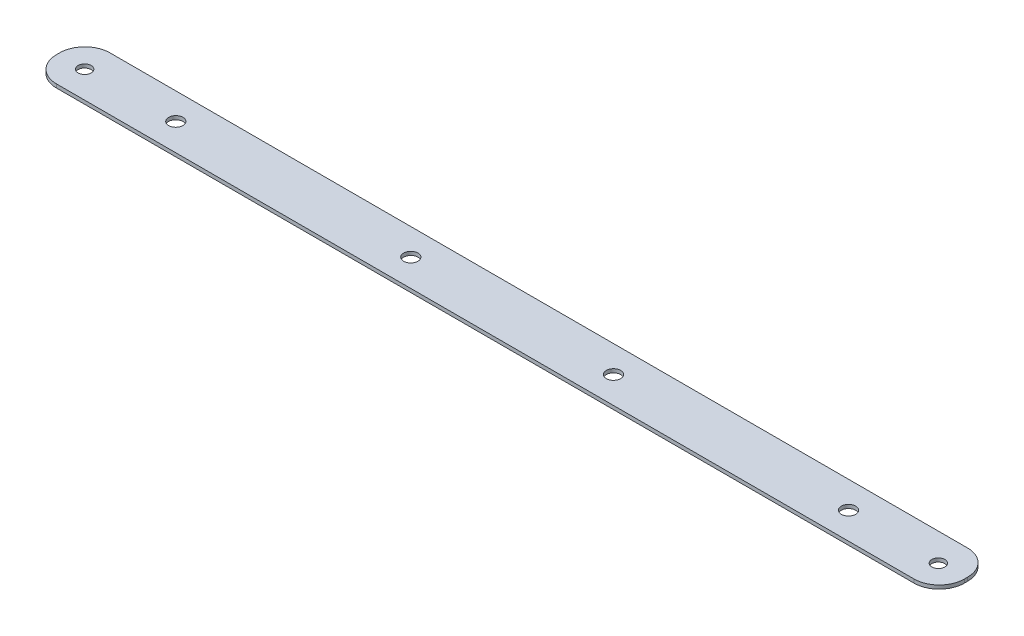
from build123d import *

# Parameters (mm, degrees)
SKETCH1_W                = 215.9
SKETCH1_H                = 12.75
SKETCH1_R                = 1.55
BASE_FLANGE1_DEPTH       = 0.86
FILLET1_R                = 6
M3_CLEARANCE_HOLE1_D     = 3.4
M3_CLEARANCE_HOLE1_DEPTH = 1.29
M3_CLEARANCE_HOLE1_TIP   = 1.021463052
SKETCH14_R               = 1.55
CUT_EXTRUDE1_DEPTH       = 82


# Sheet-metal steps are written as plain solids
with BuildPart() as part:
    # Sketch1 → Base-Flange1 (new body)
    with BuildSketch(Plane(origin=(0, 0, 0), x_dir=(1, 0, 0), z_dir=(0, 1, 0))):
        Rectangle(SKETCH1_W, SKETCH1_H)
        with Locations(Location((-101.6, 0, 0), (0, 0, 270))):
            Circle(SKETCH1_R, mode=Mode.SUBTRACT)
    extrude(amount=-BASE_FLANGE1_DEPTH)

    # Fillet1
    fillet1_edges = [part.edges().sort_by_distance(p)[0] for p in [
        (-107.95, -0.43, -6.375),
        (107.95, -0.43, -6.375),
        (107.95, -0.43, 6.375),
        (-107.95, -0.43, 6.375),
    ]]
    fillet(fillet1_edges, radius=FILLET1_R)

    # M3 Clearance Hole1
    with Locations(Plane(origin=(0, 0, 0), x_dir=(1, 0, 0), z_dir=(0, 1, 0))):
        with Locations((-80.011608413, 0.075207541), (-24.131608413, 0.075207541), (80.01, 0), (24.13, 0)):
            Hole(M3_CLEARANCE_HOLE1_D / 2, depth=M3_CLEARANCE_HOLE1_DEPTH)
            with Locations((0, 0, -(M3_CLEARANCE_HOLE1_DEPTH + M3_CLEARANCE_HOLE1_TIP / 2))):  # 118° drill point
                Cone(0, M3_CLEARANCE_HOLE1_D / 2, M3_CLEARANCE_HOLE1_TIP, mode=Mode.SUBTRACT)

    # Sketch14 → Cut-Extrude1 (cut)
    with BuildSketch(Plane(origin=(0, 0, 0), x_dir=(1, 0, 0), z_dir=(0, 1, 0))):
        with Locations(Location((101.601385273, -0.242368773, 0), (0, 0, 270))):
            Circle(SKETCH14_R)
    extrude(amount=-CUT_EXTRUDE1_DEPTH, mode=Mode.SUBTRACT)


solid = part.part
